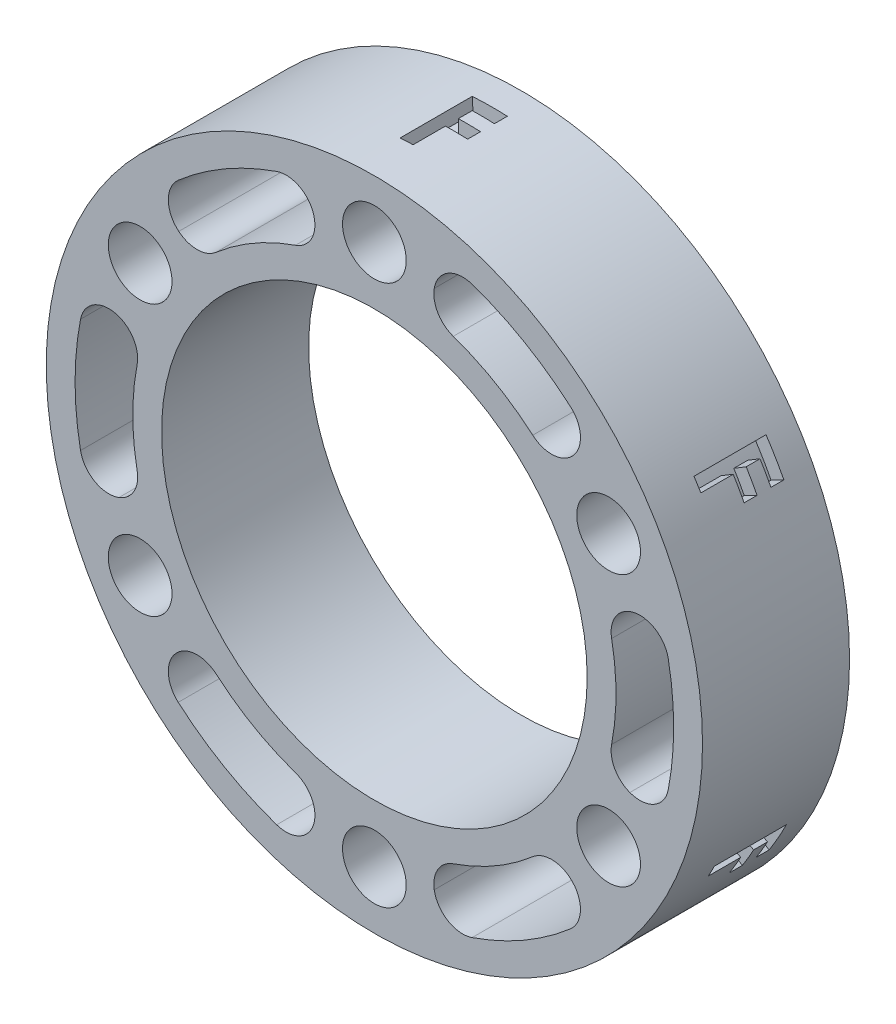
from build123d import *

# Parameters (mm, degrees)
SKETCH1_R           = 28.9052
SKETCH1_R_2         = 2.8067
SKETCH1_R_3         = 18.7452
BOSS_EXTRUDE1_DEPTH = 12.954
SHELL1_T            = -2.54
FILLET1_R           = 2.54
WRAP1_START         = 2.54
WRAP1_DEPTH         = 6.35
WRAP1_2_DEPTH       = 1.13974359
WRAP1_START_2       = 4.900897436
WRAP1_3_DEPTH       = 1.13974359
CIRPATTERN3_COUNT   = 6


# Read off the part's stored shape, not the designer's step: Wrap1
with BuildPart() as part:
    # Sketch1 → Boss-Extrude1 (new body)
    with BuildSketch(Plane.XY):
        Circle(SKETCH1_R)
        with Locations((0, 23.8252)):
            Circle(SKETCH1_R_2, mode=Mode.SUBTRACT)
        with Locations((20.63322845, 11.9126)):
            Circle(SKETCH1_R_2, mode=Mode.SUBTRACT)
        with Locations((20.63322845, -11.9126)):
            Circle(SKETCH1_R_2, mode=Mode.SUBTRACT)
        with Locations((0, -23.8252)):
            Circle(SKETCH1_R_2, mode=Mode.SUBTRACT)
        with Locations((-20.63322845, -11.9126)):
            Circle(SKETCH1_R_2, mode=Mode.SUBTRACT)
        with Locations((-20.63322845, 11.9126)):
            Circle(SKETCH1_R_2, mode=Mode.SUBTRACT)
        Circle(SKETCH1_R_3, mode=Mode.SUBTRACT)
    extrude(amount=BOSS_EXTRUDE1_DEPTH)

    # Shell1
    shell1_openings = [part.faces().sort_by_distance(p)[0] for p in [
        (-28.087637483, 0, 12.954),
    ]]
    offset(amount=SHELL1_T, openings=shell1_openings)

    # Fillet1
    fillet1_edges = [part.edges().sort_by_distance(p)[0] for p in [
        (4.422660927, 20.820658236, 7.747),
        (-4.422660927, 20.820658236, 7.747),
        (4.927440918, 25.900658236, 7.747),
        (-4.927440918, 25.900658236, 7.747),
        (-20.242549419, 6.580192403, 7.747),
        (-15.819888492, 14.240465833, 7.747),
        (-24.894348466, 8.683040107, 7.747),
        (-19.966907548, 17.217618129, 7.747),
        (19.966907548, 17.217618129, 7.747),
        (24.894348466, 8.683040107, 7.747),
        (15.819888492, 14.240465833, 7.747),
        (20.242549419, 6.580192403, 7.747),
        (19.966907548, -17.217618129, 7.747),
        (24.894348466, -8.683040107, 7.747),
        (15.819888492, -14.240465833, 7.747),
        (20.242549419, -6.580192403, 7.747),
        (-4.927440918, -25.900658236, 7.747),
        (4.927440918, -25.900658236, 7.747),
        (-4.422660927, -20.820658236, 7.747),
        (4.422660927, -20.820658236, 7.747),
        (-15.819888492, -14.240465833, 7.747),
        (-20.242549419, -6.580192403, 7.747),
        (-19.966907548, -17.217618129, 7.747),
        (-24.894348466, -8.683040107, 7.747),
    ]]
    fillet(fillet1_edges, radius=FILLET1_R - 0.0001)  # a hair under: the kernel refuses the full size

    # Wrap1 outline → Wrap1 (cut)
    with BuildSketch(Plane.XY.offset(WRAP1_START)):
        with BuildLine():
            Line((-0.627114985, 27.628083644), (-0.655934608, 28.897756605))
            ThreePointArc((-0.655934608, 28.897756605), (-1.225495275, 28.879209622), (-1.79457962, 28.849437967))
            Line((-1.79457962, 28.849437967), (-1.715731658, 27.581887969))
            ThreePointArc((-1.715731658, 27.581887969), (-1.171651018, 27.610351554), (-0.627114985, 27.628083644))
        make_face()
    wrap1 = extrude(amount=WRAP1_DEPTH, mode=Mode.SUBTRACT)

    # Wrap1 2 outline → Wrap1 2 (cut)
    with BuildSketch(Plane.XY.offset(WRAP1_START)):
        with BuildLine():
            Line((1.240414833, 27.607347755), (1.297419192, 28.876067781))
            ThreePointArc((1.297419192, 28.876067781), (0.320925566, 28.903418376), (-0.655934608, 28.897756605))
            Line((-0.655934608, 28.897756605), (-0.627114985, 27.628083644))
            ThreePointArc((-0.627114985, 27.628083644), (0.306825146, 27.633496654), (1.240414833, 27.607347755))
        make_face()
    wrap1_2 = extrude(amount=WRAP1_2_DEPTH, mode=Mode.SUBTRACT)

    # Wrap1 3 outline → Wrap1 3 (cut)
    with BuildSketch(Plane.XY.offset(WRAP1_START_2)):
        with BuildLine():
            Line((1.240414833, 27.607347755), (1.297419192, 28.876067781))
            ThreePointArc((1.297419192, 28.876067781), (0.320925566, 28.903418376), (-0.655934608, 28.897756605))
            Line((-0.655934608, 28.897756605), (-0.627114985, 27.628083644))
            ThreePointArc((-0.627114985, 27.628083644), (0.306825146, 27.633496654), (1.240414833, 27.607347755))
        make_face()
    wrap1_3 = extrude(amount=WRAP1_3_DEPTH, mode=Mode.SUBTRACT)

    # CirPattern3: Wrap1, Wrap1 2, Wrap1 3 ×6 about axis
    cirpattern3_axis = Axis((0, 0, 0), (0, 0, 1))
    add([wrap1.rotate(cirpattern3_axis, i * 360 / CIRPATTERN3_COUNT) for i in range(1, CIRPATTERN3_COUNT)], mode=Mode.SUBTRACT)
    add([wrap1_2.rotate(cirpattern3_axis, i * 360 / CIRPATTERN3_COUNT) for i in range(1, CIRPATTERN3_COUNT)], mode=Mode.SUBTRACT)
    add([wrap1_3.rotate(cirpattern3_axis, i * 360 / CIRPATTERN3_COUNT) for i in range(1, CIRPATTERN3_COUNT)], mode=Mode.SUBTRACT)


solid = part.part
